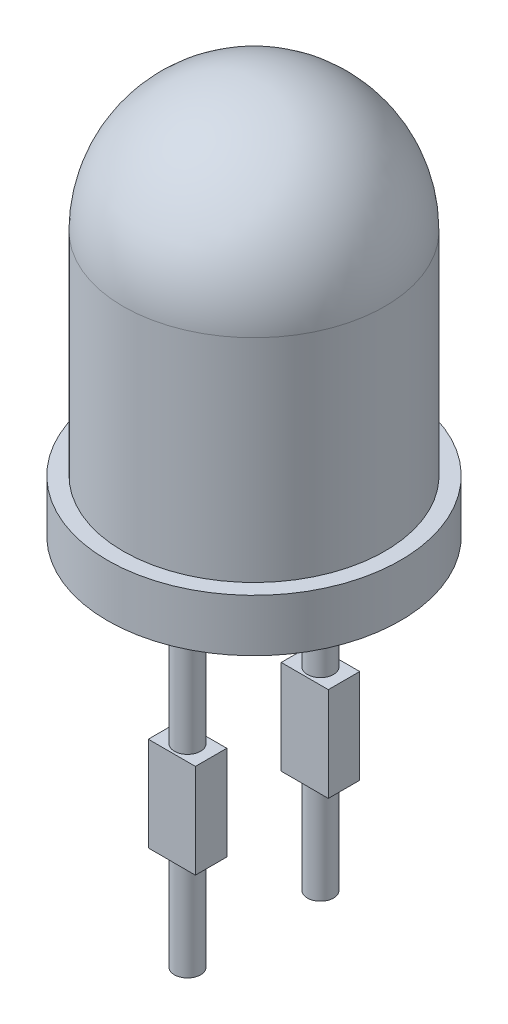
from build123d import *

# Parameters (mm, degrees)
SKETCH2_R               = 0.25
BOSS_EXTRUDE1_DEPTH     = 11
BOSS_EXTRUDE1_2_DEPTH   = 11
SKETCH3_W               = 0.6
SKETCH3_H               = 1.8
BOSS_EXTRUDE2_DEPTH     = 0.45
CUT_EXTRUDE1_DEPTH      = 15.573284633
CUT_EXTRUDE1_DEPTH_BACK = 15.573284633
SKETCH4_W               = 7.84837635
SKETCH4_H               = 5.69268898


with BuildPart() as part:
    # Sketch1 → Revolve1 (revolve)
    with BuildSketch(Plane(origin=(0, 0, 0), x_dir=(0, 0, -1), z_dir=(1, 0, 0))):
        with BuildLine():
            Line((-2.5, 2.025), (-2.5, -2.025))
            Line((-2.5, -2.025), (-2.8, -2.025))
            Line((-2.8, -2.025), (-2.8, -3.025))
            Line((-2.8, -3.025), (0, -3.025))
            Line((0, -3.025), (0, 4.525))
            ThreePointArc((0, 4.525), (-1.767766953, 3.792766953), (-2.5, 2.025))
        make_face()
    revolve(axis=Axis((0, 4.525, 0), (0, -1, 0)))


with BuildPart() as body_2:
    # Sketch2 → Boss-Extrude1 (new body)
    with BuildSketch(Plane.XZ.offset(3.025)):
        with Locations((0, 1.27)):
            Circle(SKETCH2_R)
    extrude(amount=BOSS_EXTRUDE1_DEPTH)



with BuildPart() as body_3:
    # Sketch2 → Boss-Extrude1 2 (new body)
    with BuildSketch(Plane.XZ.offset(3.025)):
        with Locations((0, -1.27)):
            Circle(SKETCH2_R)
    extrude(amount=BOSS_EXTRUDE1_2_DEPTH)


with BuildPart() as body_2_1:
    add(body_2.part)

    add(body_3.part)  # Boss-Extrude2 merges body 3
    # Sketch3 → Boss-Extrude2 (add, symmetric)
    with BuildSketch(Plane(origin=(0, 0, 0), x_dir=(0, 0, -1), z_dir=(1, 0, 0))):
        with Locations((1.27, -6.725)):
            Rectangle(SKETCH3_W, SKETCH3_H)
        with Locations((-1.27, -6.725)):
            Rectangle(SKETCH3_W, SKETCH3_H)
    extrude(amount=BOSS_EXTRUDE2_DEPTH, both=True)

    # Sketch4 → Cut-Extrude1 (cut, two sides: drawn at the far end of the back side and taken through both)
    with BuildSketch(Plane.XY.offset(-CUT_EXTRUDE1_DEPTH_BACK)):
        with Locations((0.313935054, -12.37134449)):
            Rectangle(SKETCH4_W, SKETCH4_H)
    extrude(amount=CUT_EXTRUDE1_DEPTH + CUT_EXTRUDE1_DEPTH_BACK, mode=Mode.SUBTRACT)


solid = Compound([part.part, body_2_1.part])
